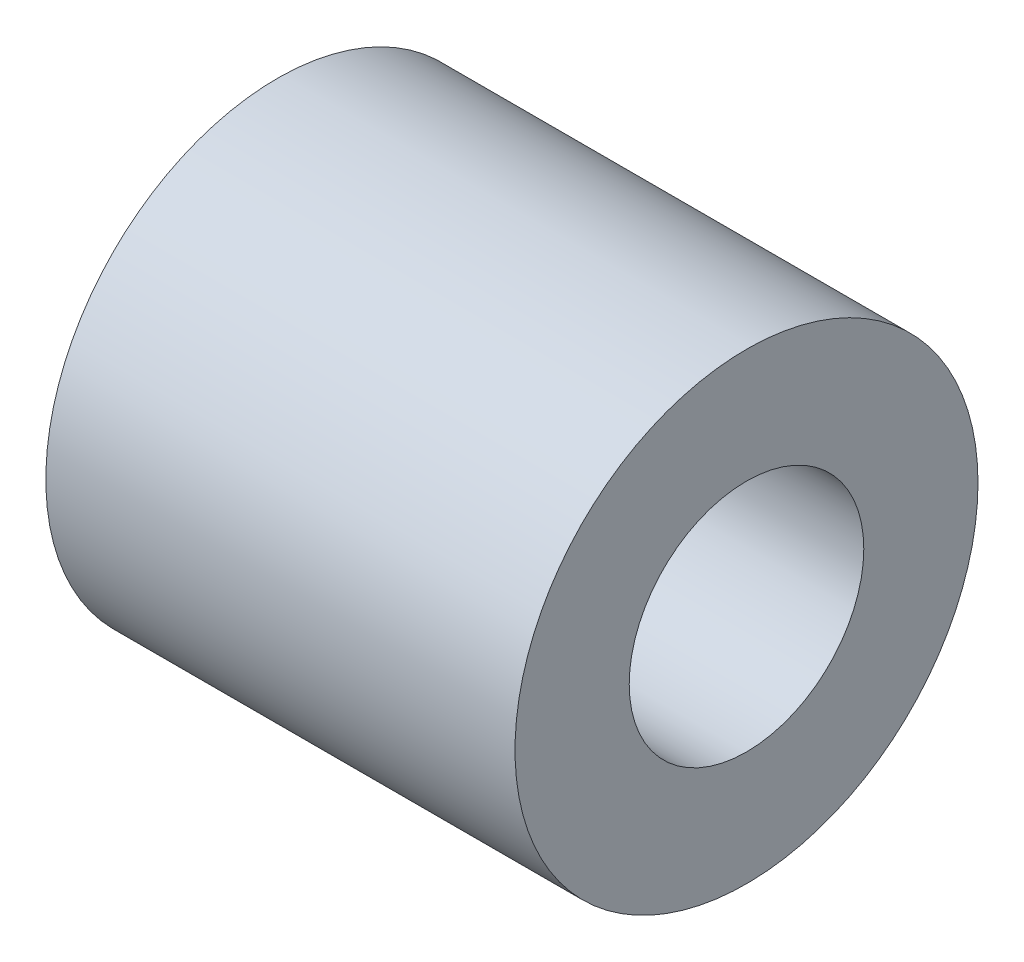
from build123d import *

# Parameters (mm, degrees)
SKETCH1_R           = 4.7625
SKETCH1_R_2         = 2.413
BOSS_EXTRUDE1_DEPTH = 4.826


with BuildPart() as part:
    # Sketch1 → Boss-Extrude1 (new, symmetric)
    with BuildSketch(Plane(origin=(0, 0, 0), x_dir=(0, 0, -1), z_dir=(1, 0, 0))):
        Circle(SKETCH1_R)
        Circle(SKETCH1_R_2, mode=Mode.SUBTRACT)
    extrude(amount=BOSS_EXTRUDE1_DEPTH, both=True)


solid = part.part
